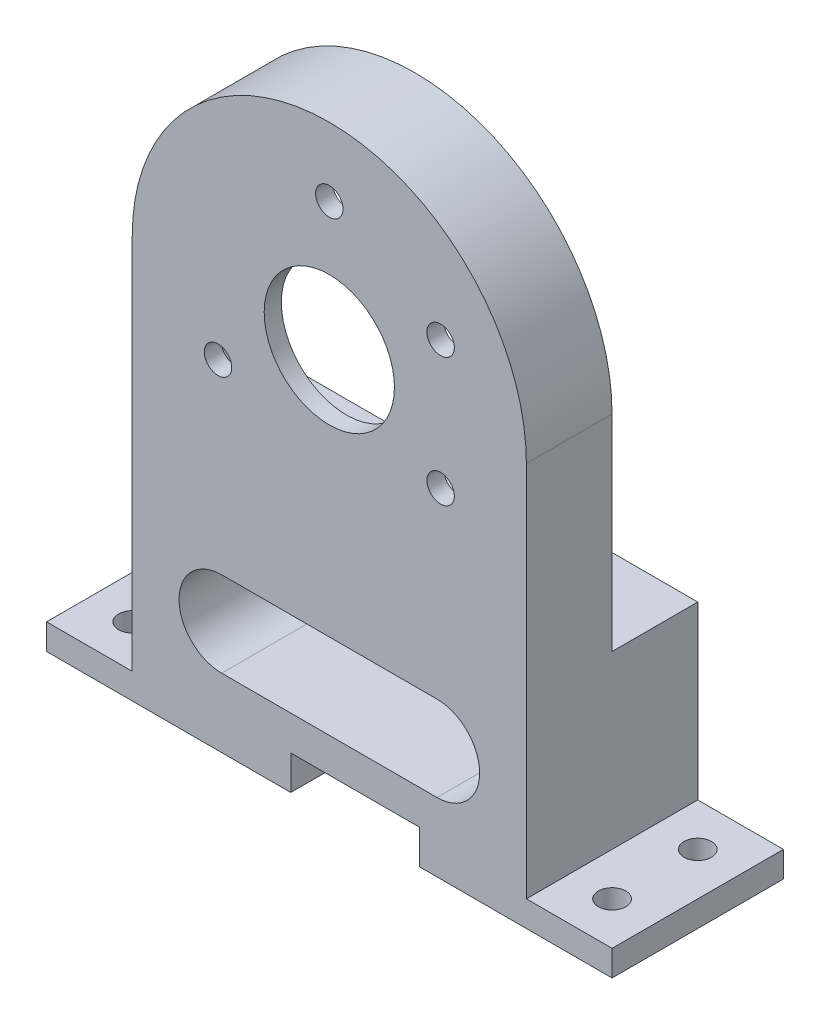
from build123d import *

# Parameters (mm, degrees)
EXTRUDE_1_DEPTH      = 20
CUT_EXTRUDE_1_DEPTH  = 10
SKETCH_3_R           = 21.1
CUT_EXTRUDE_2_DEPTH  = 8
SKETCH_7_R           = 1.6
CUT_EXTRUDE_6_DEPTH  = 3
SKETCH_8_R           = 7.6
CUT_EXTRUDE_7_DEPTH  = 3
SKETCH_12_W          = 46
SKETCH_12_H          = 20
EXTRUDE_4_DEPTH      = 20
SKETCH_14_W          = 10
SKETCH_14_H          = 20
SKETCH_14_R          = 1.6
EXTRUDE_5_DEPTH      = 3
SKETCH_16_W          = 15
SKETCH_16_H          = 20
CUT_EXTRUDE_10_DEPTH = 4
CUT_EXTRUDE_11_DEPTH = 61.811183182


with BuildPart() as part:
    # 草图1 → 凸台-拉伸1 (new body)
    with BuildSketch(Plane.XY):
        with BuildLine():
            Line((-23, 0), (-23, -27))
            Line((-23, -27), (23, -27))
            Line((23, -27), (23, 0))
            ThreePointArc((23, 0), (0, 23), (-23, 0))
        make_face()
    extrude(amount=EXTRUDE_1_DEPTH)

    # 草图2 → 切除-拉伸1 (cut)
    with BuildSketch(Plane(origin=(0, 0, 0), x_dir=(-1, 0, 0), z_dir=(0, 0, -1))):
        with BuildLine():
            Line((-23, -24), (23, -24))
            Line((23, -24), (23, 0))
            ThreePointArc((23, 0), (0, 23), (-23, 0))
            Line((-23, 0), (-23, -24))
        make_face()
    extrude(amount=-CUT_EXTRUDE_1_DEPTH, mode=Mode.SUBTRACT)

    # 草图3 → 切除-拉伸2 (cut)
    with BuildSketch(Plane(origin=(0, 0, 10), x_dir=(-1, 0, 0), z_dir=(0, 0, -1))):
        Circle(SKETCH_3_R)
    extrude(amount=-CUT_EXTRUDE_2_DEPTH, mode=Mode.SUBTRACT)

    # 草图7 → 切除-拉伸6 (cut)
    with BuildSketch(Plane.XY.offset(20)):
        with Locations((0, 15)):
            Circle(SKETCH_7_R)
        with Locations((12.990381057, 7.5)):
            Circle(SKETCH_7_R)
        with Locations((12.990381057, -7.5)):
            Circle(SKETCH_7_R)
        with Locations((-12.990381057, -7.5)):
            Circle(SKETCH_7_R)
    extrude(amount=-CUT_EXTRUDE_6_DEPTH, mode=Mode.SUBTRACT)

    # 草图8 → 切除-拉伸7 (cut)
    with BuildSketch(Plane(origin=(0, 0, 18), x_dir=(-1, 0, 0), z_dir=(0, 0, -1))):
        Circle(SKETCH_8_R)
    extrude(amount=-CUT_EXTRUDE_7_DEPTH, mode=Mode.SUBTRACT)

    # 草图12 → 凸台-拉伸4 (add)
    with BuildSketch(Plane.XZ.offset(27)):
        with Locations((0, 10)):
            Rectangle(SKETCH_12_W, SKETCH_12_H)
    extrude(amount=EXTRUDE_4_DEPTH)

    # 草图14 → 凸台-拉伸5 (add)
    # profile 1 of 2: a face of its own
    with BuildSketch(Plane.XZ.offset(47)):
        with Locations((28, 10)):
            Rectangle(SKETCH_14_W, SKETCH_14_H)
        with Locations((28, 5)):
            Circle(SKETCH_14_R, mode=Mode.SUBTRACT)
        with Locations((28, 15)):
            Circle(SKETCH_14_R, mode=Mode.SUBTRACT)
    # profile 2 of 2: a face of its own
    with BuildSketch(Plane.XZ.offset(47)):
        with Locations((-28, 10)):
            Rectangle(SKETCH_14_W, SKETCH_14_H)
        with Locations((-28, 5)):
            Circle(SKETCH_14_R, mode=Mode.SUBTRACT)
        with Locations((-28, 15)):
            Circle(SKETCH_14_R, mode=Mode.SUBTRACT)
    extrude(amount=-EXTRUDE_5_DEPTH)

    # 草图16 → 切除-拉伸10 (cut)
    with BuildSketch(Plane.XZ.offset(47)):
        with Locations((3, 10)):
            Rectangle(SKETCH_16_W, SKETCH_16_H)
    extrude(amount=-CUT_EXTRUDE_10_DEPTH, mode=Mode.SUBTRACT)

    # 草图17 → 切除-拉伸11 (cut, through all)
    with BuildSketch(Plane(origin=(0, 0, 0), x_dir=(-1, 0, 0), z_dir=(0, 0, -1))):
        with BuildLine():
            Line((-12.566151066, -29.028305096), (12.566151066, -29.028305096))
            ThreePointArc((12.566151066, -29.028305096), (17.53784597, -34), (12.566151066, -38.971694904))
            Line((12.566151066, -38.971694904), (-12.566151066, -38.971694904))
            ThreePointArc((-12.566151066, -38.971694904), (-17.53784597, -34), (-12.566151066, -29.028305096))
        make_face()
    extrude(amount=-CUT_EXTRUDE_11_DEPTH, mode=Mode.SUBTRACT)


solid = part.part
